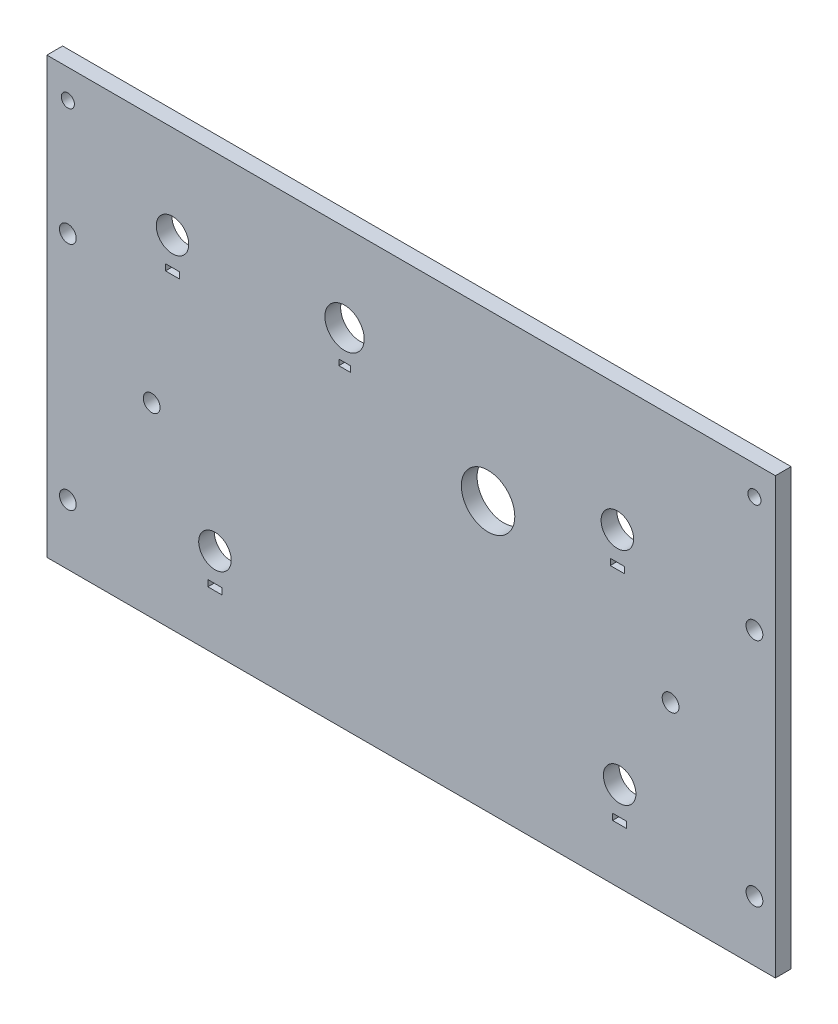
from build123d import *

# Parameters (mm, degrees)
SKETCH1_W           = 139
SKETCH1_H           = 83
SKETCH1_R           = 1.6
SKETCH1_R_2         = 3.75
SKETCH1_R_3         = 3.1
SKETCH1_R_4         = 5.1
SKETCH1_R_5         = 1.25
SKETCH1_W_2         = 2.2
SKETCH1_H_2         = 1.1
SKETCH1_W_3         = 2.7
SKETCH1_H_3         = 1.2
BOSS_EXTRUDE1_DEPTH = 3


with BuildPart() as part:
    # Sketch1 → Boss-Extrude1 (new body)
    with BuildSketch(Plane.XY):
        with Locations((69.5, 41.5)):
            Rectangle(SKETCH1_W, SKETCH1_H)
        with Locations((4, 55.5)):
            Circle(SKETCH1_R, mode=Mode.SUBTRACT)
        with Locations((135, 55.5)):
            Circle(SKETCH1_R, mode=Mode.SUBTRACT)
        with Locations((135, 11.5)):
            Circle(SKETCH1_R, mode=Mode.SUBTRACT)
        with Locations((4, 11.5)):
            Circle(SKETCH1_R, mode=Mode.SUBTRACT)
        with Locations((20, 35.528267227)):
            Circle(SKETCH1_R, mode=Mode.SUBTRACT)
        with Locations((56.797589152, 66.327466114)):
            Circle(SKETCH1_R_2, mode=Mode.SUBTRACT)
        with Locations((119, 35.528267227)):
            Circle(SKETCH1_R, mode=Mode.SUBTRACT)
        with Locations((23.966882531, 65.247733156)):
            Circle(SKETCH1_R_3, mode=Mode.SUBTRACT)
        with Locations((32.070123038, 17.100385529)):
            Circle(SKETCH1_R_3, mode=Mode.SUBTRACT)
        with Locations((109.281287349, 17.100385529)):
            Circle(SKETCH1_R_3, mode=Mode.SUBTRACT)
        with Locations((84.178955025, 51.38060251)):
            Circle(SKETCH1_R_4, mode=Mode.SUBTRACT)
        with Locations((108.842722678, 59)):
            Circle(SKETCH1_R_3, mode=Mode.SUBTRACT)
        with Locations((135, 77.5)):
            Circle(SKETCH1_R_5, mode=Mode.SUBTRACT)
        with Locations((4, 77.5)):
            Circle(SKETCH1_R_5, mode=Mode.SUBTRACT)
        with Locations((56.797589152, 60.077466114)):
            Rectangle(SKETCH1_W_2, SKETCH1_H_2, mode=Mode.SUBTRACT)
        with Locations((32.070123038, 11.100385529)):
            Rectangle(SKETCH1_W_3, SKETCH1_H_3, mode=Mode.SUBTRACT)
        with Locations((108.842722678, 53)):
            Rectangle(SKETCH1_W_3, SKETCH1_H_3, mode=Mode.SUBTRACT)
        with Locations((23.966882531, 59.247733156)):
            Rectangle(SKETCH1_W_3, SKETCH1_H_3, mode=Mode.SUBTRACT)
        with Locations((109.281287349, 11.100385529)):
            Rectangle(SKETCH1_W_3, SKETCH1_H_3, mode=Mode.SUBTRACT)
    extrude(amount=BOSS_EXTRUDE1_DEPTH)


solid = part.part
